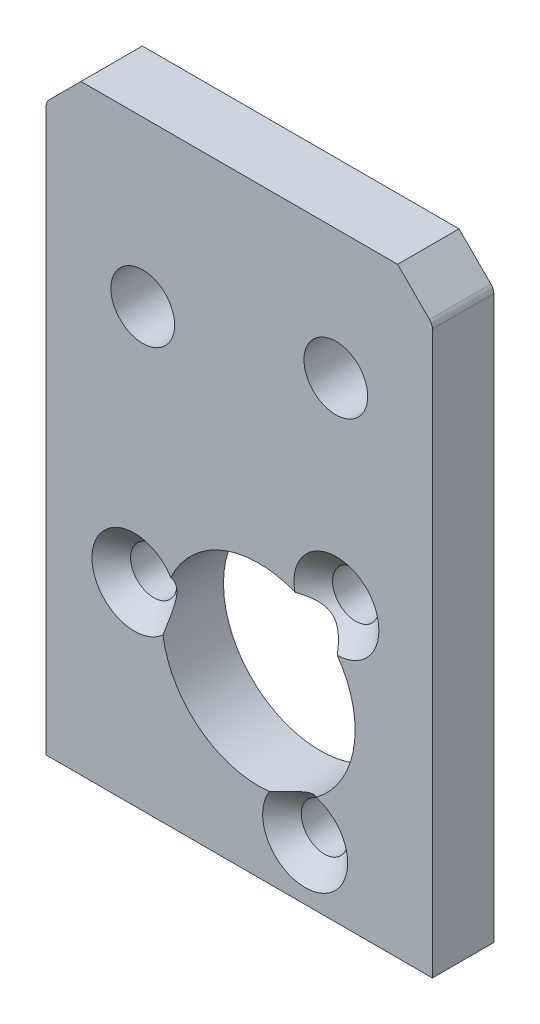
from build123d import *

# Parameters (mm, degrees)
SKETCH1_W                                       = 20
SKETCH1_H                                       = 31.11
SKETCH1_R                                       = 5
SKETCH1_R_2                                     = 1.65
SKETCH1_R_3                                     = 1.2
BOSS_EXTRUDE2_DEPTH                             = 3.18
CSK_FOR_M2_FLAT_HEAD_MACHINE_SCREW1_D           = 2.4
CSK_FOR_M2_FLAT_HEAD_MACHINE_SCREW1_DEPTH       = 3.508967257
CSK_FOR_M2_FLAT_HEAD_MACHINE_SCREW1_CSINK_D     = 4.4
CSK_FOR_M2_FLAT_HEAD_MACHINE_SCREW1_CSINK_ANGLE = 90
CSK_FOR_M2_FLAT_HEAD_MACHINE_SCREW1_TIP         = 0.721032743
CHAMFER1_SIZE                                   = 1.8
FILLET1_R                                       = 0.5


with BuildPart() as part:
    # Sketch1 → Boss-Extrude2 (new body)
    with BuildSketch(Plane.XY):
        with Locations((10, 15.555)):
            Rectangle(SKETCH1_W, SKETCH1_H)
        with Locations((11, 9.11)):
            Circle(SKETCH1_R, mode=Mode.SUBTRACT)
        with Locations((5, 22.61)):
            Circle(SKETCH1_R_2, mode=Mode.SUBTRACT)
        with Locations((15, 24.41)):
            Circle(SKETCH1_R_2, mode=Mode.SUBTRACT)
        with Locations((15.03, 14.21)):
            Circle(SKETCH1_R_3, mode=Mode.SUBTRACT)
        with Locations((4.57, 10.04)):
            Circle(SKETCH1_R_3, mode=Mode.SUBTRACT)
        with Locations((13.41, 2.96)):
            Circle(SKETCH1_R_3, mode=Mode.SUBTRACT)
    extrude(amount=-BOSS_EXTRUDE2_DEPTH)

    # CSK for M2 Flat Head Machine Screw1
    with Locations(Plane.XY):
        with Locations((4.57, 10.04), (15.03, 14.21), (13.41, 2.96)):
            CounterSinkHole(CSK_FOR_M2_FLAT_HEAD_MACHINE_SCREW1_D / 2, CSK_FOR_M2_FLAT_HEAD_MACHINE_SCREW1_CSINK_D / 2, depth=CSK_FOR_M2_FLAT_HEAD_MACHINE_SCREW1_DEPTH, counter_sink_angle=CSK_FOR_M2_FLAT_HEAD_MACHINE_SCREW1_CSINK_ANGLE)
            with Locations((0, 0, -(CSK_FOR_M2_FLAT_HEAD_MACHINE_SCREW1_DEPTH + CSK_FOR_M2_FLAT_HEAD_MACHINE_SCREW1_TIP / 2))):  # 118° drill point
                Cone(0, CSK_FOR_M2_FLAT_HEAD_MACHINE_SCREW1_D / 2, CSK_FOR_M2_FLAT_HEAD_MACHINE_SCREW1_TIP, mode=Mode.SUBTRACT)

    # Chamfer1
    chamfer1_edges = [part.edges().sort_by_distance(p)[0] for p in [
        (0, 31.11, -1.59),
        (20, 31.11, -1.59),
    ]]
    chamfer(chamfer1_edges, length=CHAMFER1_SIZE)

    # Fillet1
    fillet1_edges = [part.edges().sort_by_distance(p)[0] for p in [
        (20, 29.31, -1.59),
        (0, 29.31, -1.59),
    ]]
    fillet(fillet1_edges, radius=FILLET1_R)


solid = part.part
